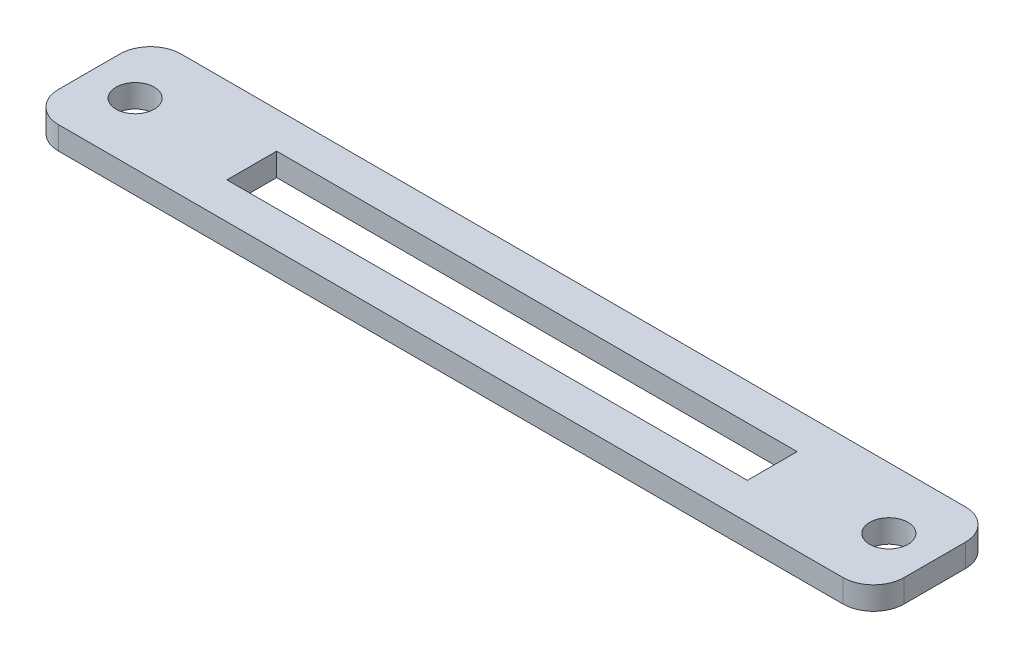
from build123d import *

# Parameters (mm, degrees)
SKETCH1_W                   = 37
SKETCH1_H                   = 8
SKETCH1_W_2                 = 34
SKETCH1_H_2                 = 3.25
BASE_FLANGE1_DEPTH          = 1.5
EDGE_FLANGE1_DEPTH          = 8
EDGE_FLANGE1_BEND_DEPTH     = 8
TAP_DRILL_FOR_M3X0_5_TAP1_D = 2.5
FILLET1_START               = -8.5
FILLET1_OUTLINE_W           = 43.3
FILLET1_OUTLINE_H           = 8
FILLET1_OUTLINE_W_2         = 34
FILLET1_OUTLINE_H_2         = 3.25
FILLET1_DEPTH               = 7
FILLET1_START_2             = -1.5
FILLET1_2_OUTLINE_R         = 1.25
FILLET1_2_OUTLINE_W         = 34
FILLET1_2_OUTLINE_H         = 3.25
FILLET1_2_DEPTH             = 1.5


with BuildPart() as part:
    # Base-Flange1: sheet metal written as solids
    # Sketch1 → Base-Flange1 (new body)
    with BuildSketch(Plane(origin=(0, 0, 0), x_dir=(1, 0, 0), z_dir=(0, 1, 0))):
        with Locations((18.5, 4)):
            Rectangle(SKETCH1_W, SKETCH1_H)
        with Locations((18.5, 4)):
            Rectangle(SKETCH1_W_2, SKETCH1_H_2, mode=Mode.SUBTRACT)
    extrude(amount=-BASE_FLANGE1_DEPTH)

    # Edge-Flange1: sheet metal written as solids
    # Edge-Flange1 section (on a plane across the edge) → Edge-Flange1 (add)
    with BuildSketch(Plane(origin=(-1.65, -1.5, 0), x_dir=(1, 0, 0), z_dir=(0, 0, -1))):
        with BuildLine():
            Line((-1.5, 1.65), (-1.5, 7))
            Line((-1.5, 7), (0, 7))
            Line((0, 7), (0, 1.65))
            ThreePointArc((0, 1.65), (0.483273811, 0.483273811), (1.65, 0))
            Line((1.65, 0), (1.65, -1.5))
            ThreePointArc((1.65, -1.5), (-0.577386361, -0.577386361), (-1.5, 1.65))
        make_face()
    extrude(amount=EDGE_FLANGE1_DEPTH)

    # Edge-Flange1 section 2 (on a plane across the edge) → Edge-Flange1 bend (add)
    with BuildSketch(Plane(origin=(38.65, -1.5, -8), x_dir=(-1, 0, 0), z_dir=(0, 0, 1))):
        with BuildLine():
            Line((-1.5, 1.65), (-1.5, 7))
            Line((-1.5, 7), (0, 7))
            Line((0, 7), (0, 1.65))
            ThreePointArc((0, 1.65), (0.483273811, 0.483273811), (1.65, 0))
            Line((1.65, 0), (1.65, -1.5))
            ThreePointArc((1.65, -1.5), (-0.577386361, -0.577386361), (-1.5, 1.65))
        make_face()
    extrude(amount=EDGE_FLANGE1_BEND_DEPTH)

    # Tap Drill for M3x0.5 Tap1 (through all)
    with Locations(Plane(origin=(40.15, 0, 0), x_dir=(0, 0, -1), z_dir=(1, 0, 0))):
        with Locations((4, -5.5)):
            Hole(TAP_DRILL_FOR_M3X0_5_TAP1_D / 2)

    # Fillet1: read off the stored shape, not the designer's step
    # Fillet1 outline → Fillet1 (cut)
    with BuildSketch(Plane(origin=(0, 0, 0), x_dir=(1, 0, 0), z_dir=(0, 1, 0)).offset(FILLET1_START)):
        with Locations((18.5, 4)):
            Rectangle(FILLET1_OUTLINE_W, FILLET1_OUTLINE_H)
        with Locations((18.5, 4)):
            Rectangle(FILLET1_OUTLINE_W_2, FILLET1_OUTLINE_H_2, mode=Mode.SUBTRACT)
    extrude(amount=FILLET1_DEPTH, mode=Mode.SUBTRACT)

    # Fillet1 2 outline → Fillet1 2 (add)
    with BuildSketch(Plane(origin=(0, 0, 0), x_dir=(1, 0, 0), z_dir=(0, 1, 0)).offset(FILLET1_START_2)):
        with BuildLine():
            Line((-9.119911184, 6), (-9.119911184, 2))
            ThreePointArc((-9.119911184, 2), (-8.534124747, 0.585786438), (-7.119911184, 0))
            Line((-7.119911184, 0), (44.119911184, 0))
            ThreePointArc((44.119911184, 0), (45.534124747, 0.585786438), (46.119911184, 2))
            Line((46.119911184, 2), (46.119911184, 6))
            ThreePointArc((46.119911184, 6), (45.534124747, 7.414213562), (44.119911184, 8))
            Line((44.119911184, 8), (-7.119911184, 8))
            ThreePointArc((-7.119911184, 8), (-8.534124747, 7.414213562), (-9.119911184, 6))
        make_face()
        with Locations((-6.119911184, 4)):
            Circle(FILLET1_2_OUTLINE_R, mode=Mode.SUBTRACT)
        with Locations((18.5, 4)):
            Rectangle(FILLET1_2_OUTLINE_W, FILLET1_2_OUTLINE_H, mode=Mode.SUBTRACT)
        with Locations((43.119911184, 4)):
            Circle(FILLET1_2_OUTLINE_R, mode=Mode.SUBTRACT)
    extrude(amount=FILLET1_2_DEPTH)


solid = part.part
